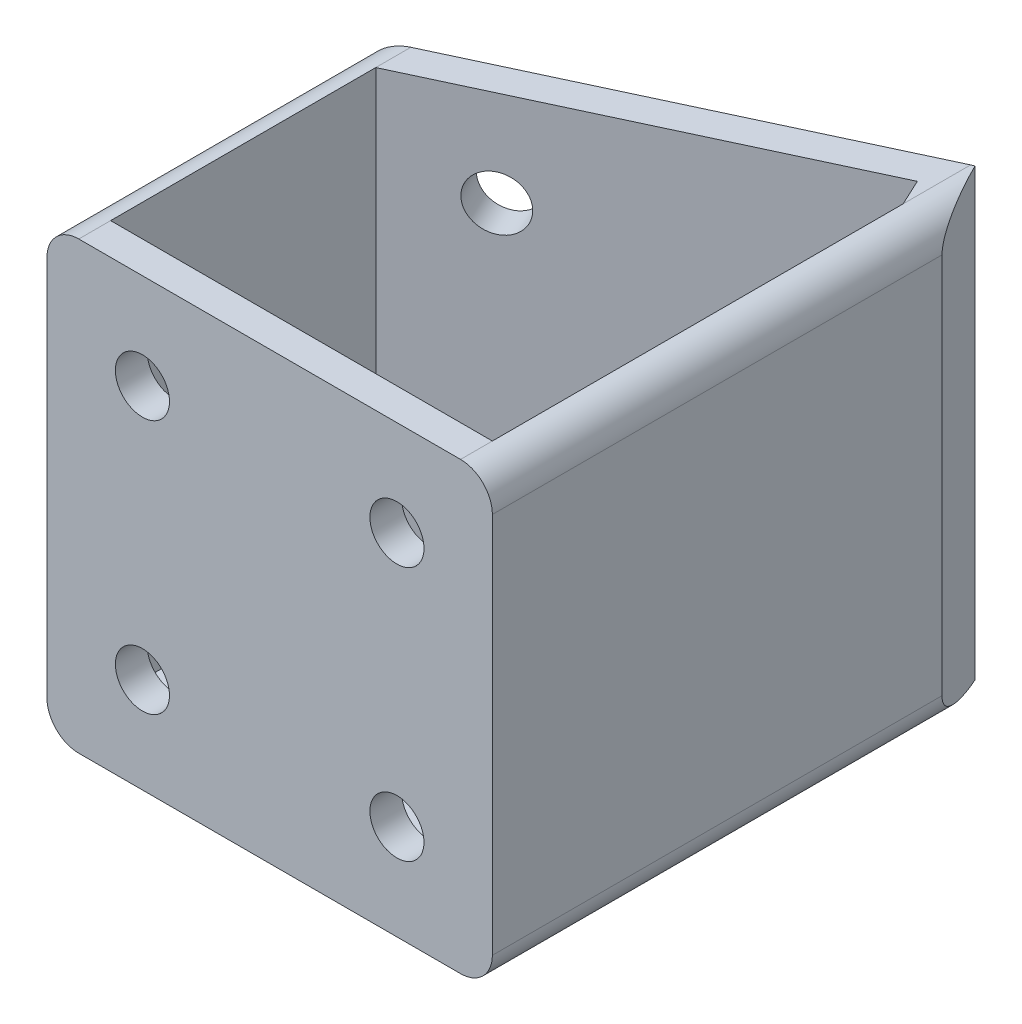
from build123d import *

# Parameters (mm, degrees)
SKETCH1_W           = 28
SKETCH1_H           = 28
BOSS_EXTRUDE1_DEPTH = 33
SKETCH3_W           = 49.200789626
SKETCH3_H           = 42.103599699
CUT_EXTRUDE1_DEPTH  = 15
FILLET1_R           = 2
SKETCH7_W           = 35.932527634
SKETCH7_H           = 14.196879105
CUT_EXTRUDE3_DEPTH  = 2
SHELL1_START        = -12
SHELL1_DEPTH        = 26
SKETCH8_R           = 1.7
CUT_EXTRUDE4_DEPTH  = 2
SKETCH9_R           = 1.590347025
SKETCH9_R_2         = 1.7
CUT_EXTRUDE5_DEPTH  = 2


# Read off the part's stored shape, not the designer's step: Shell1
with BuildPart() as part:
    # Sketch1 → Boss-Extrude1 (new body)
    with BuildSketch(Plane.XY):
        Rectangle(SKETCH1_W, SKETCH1_H)
    extrude(amount=BOSS_EXTRUDE1_DEPTH)

    # Sketch3 → Cut-Extrude1 (cut)
    with BuildSketch(Plane(origin=(2.500486732, 0, 5.362311102), x_dir=(0, 1, 0), z_dir=(0.4226182617407003, 0, 0.9063077870366496))):
        with Locations((-1.181385954, 1.948035585)):
            Rectangle(SKETCH3_W, SKETCH3_H)
    extrude(amount=-CUT_EXTRUDE1_DEPTH, mode=Mode.SUBTRACT)

    # Fillet1
    fillet1_edges = [part.edges().sort_by_distance(p)[0] for p in [
        (14, -14, 16.5),
        (-14, -14, 23.028307214),
        (-14, 14, 23.028307214),
        (14, 14, 16.5),
    ]]
    fillet(fillet1_edges, radius=FILLET1_R)

    # Sketch7 → Cut-Extrude3 (cut)
    with BuildSketch(Plane(origin=(11.499513268, 0, -5.362311102), x_dir=(0, 1, 0), z_dir=(0.9063077870366496, 0, -0.4226182617407003))):
        with Locations((0.607628843, 7.098439553)):
            Rectangle(SKETCH7_W, SKETCH7_H)
    extrude(amount=-CUT_EXTRUDE3_DEPTH, mode=Mode.SUBTRACT)

    # Shell1 outline → Shell1 (cut)
    with BuildSketch(Plane(origin=(0, 0, 0), x_dir=(1, 0, 0), z_dir=(0, 1, 0)).offset(SHELL1_START)):
        Polygon((12, -31), (12, -5.175792492), (11.220005375, -3.503088621), (-12, -14.33075495), (-12, -31), align=None)
    extrude(amount=SHELL1_DEPTH, mode=Mode.SUBTRACT)

    # Sketch8 → Cut-Extrude4 (cut)
    with BuildSketch(Plane.XY.offset(33)):
        with Locations((-8, 8)):
            Circle(SKETCH8_R)
        with Locations((8, 8)):
            Circle(SKETCH8_R)
        with Locations((8, -8)):
            Circle(SKETCH8_R)
        with Locations((-8, -8)):
            Circle(SKETCH8_R)
    extrude(amount=-CUT_EXTRUDE4_DEPTH, mode=Mode.SUBTRACT)

    # Sketch9 → Cut-Extrude5 (cut)
    with BuildSketch(Plane(origin=(2.500486732, 0, 5.362311102), x_dir=(-0.9063077870366496, 0, 0.4226182617407002), z_dir=(-0.4226182617407003, 0, -0.9063077870366497))):
        with Locations((11.206272712, -8)):
            Circle(SKETCH9_R)
        with Locations((11.206272712, 8)):
            Circle(SKETCH9_R_2)
        with Locations((-6.293727288, 0)):
            Circle(SKETCH9_R_2)
    extrude(amount=-CUT_EXTRUDE5_DEPTH, mode=Mode.SUBTRACT)


solid = part.part
